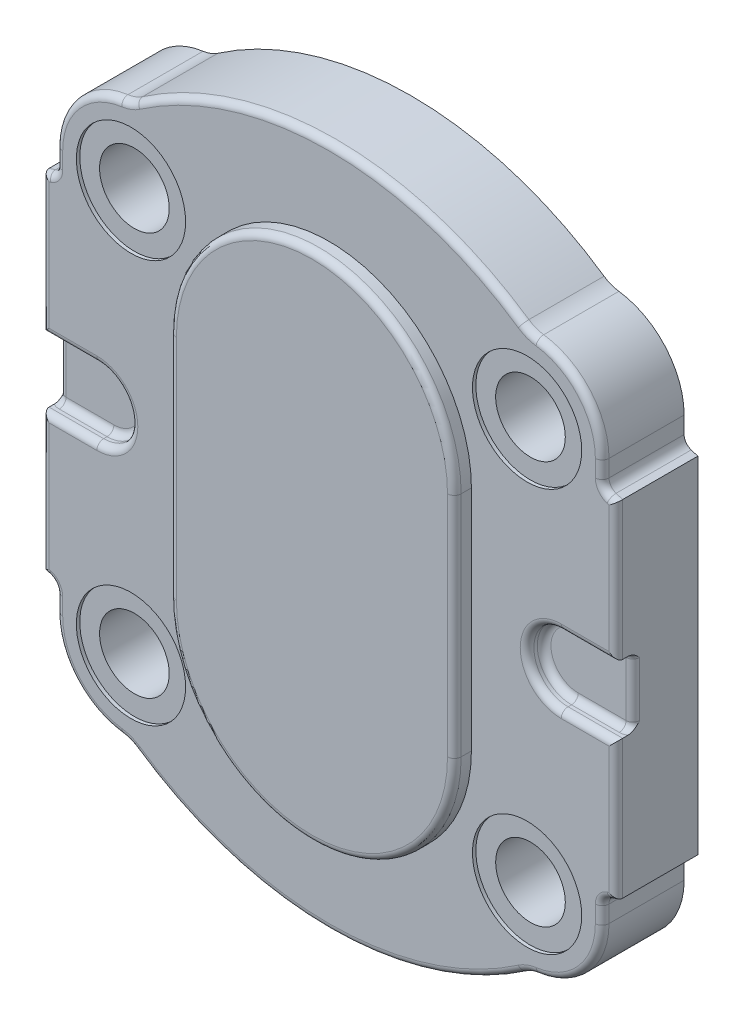
from build123d import *

# Parameters (mm, degrees)
SKETCH1_R                    = 5.1
BOSS_EXTRUDE1_DEPTH          = 12
BOSS_EXTRUDE2_DEPTH          = 2.5
CUT_EXTRUDE1_DEPTH           = 2.5
SKETCH4_R                    = 8
CUT_EXTRUDE3_DEPTH           = 0.5
FILLET1_R                    = 1
FILLET2_R                    = 1
FILLET3_R                    = 1
F_4_0_4_DIAMETER_HOLE2_D     = 4
F_4_0_4_DIAMETER_HOLE2_DEPTH = 3
F_4_0_4_DIAMETER_HOLE2_TIP   = 1.201721238


with BuildPart() as part:
    # Sketch1 → Boss-Extrude1 (new body)
    with BuildSketch(Plane.XY):
        with BuildLine():
            Line((-40, 29.5), (-40, 27.019246817))
            ThreePointArc((-40, 27.019246817), (-40.286592121, 26.137407082), (-41.036855092, 25.59253844))
            Line((-41.036855092, 25.59253844), (-42, 25.279877726))
            Line((-42, 25.279877726), (-42, -25.279877726))
            Line((-42, -25.279877726), (-41.036855092, -25.59253844))
            ThreePointArc((-41.036855092, -25.59253844), (-40.286592121, -26.137407082), (-40, -27.019246817))
            Line((-40, -27.019246817), (-40, -29.5))
            ThreePointArc((-40, -29.5), (-37.273414339, -36.74918031), (-30.445342697, -40.404631332))
            ThreePointArc((-30.445342697, -40.404631332), (-29.311006992, -40.693176357), (-28.274833318, -41.237529034))
            ThreePointArc((-28.274833318, -41.237529034), (0, -50), (28.274833318, -41.237529034))
            ThreePointArc((28.274833318, -41.237529034), (29.311006992, -40.693176357), (30.445342697, -40.404631332))
            ThreePointArc((30.445342697, -40.404631332), (37.273414339, -36.74918031), (40, -29.5))
            Line((40, -29.5), (40, -27.019246817))
            ThreePointArc((40, -27.019246817), (40.286592121, -26.137407082), (41.036855092, -25.59253844))
            Line((41.036855092, -25.59253844), (42, -25.279877726))
            Line((42, -25.279877726), (42, 25.279877726))
            Line((42, 25.279877726), (41.036855092, 25.59253844))
            ThreePointArc((41.036855092, 25.59253844), (40.286592121, 26.137407082), (40, 27.019246817))
            Line((40, 27.019246817), (40, 29.5))
            ThreePointArc((40, 29.5), (37.273414339, 36.74918031), (30.445342697, 40.404631332))
            ThreePointArc((30.445342697, 40.404631332), (29.311006992, 40.693176357), (28.274833318, 41.237529034))
            ThreePointArc((28.274833318, 41.237529034), (0, 50), (-28.274833318, 41.237529034))
            ThreePointArc((-28.274833318, 41.237529034), (-29.311006992, 40.693176357), (-30.445342697, 40.404631332))
            ThreePointArc((-30.445342697, 40.404631332), (-37.273414339, 36.74918031), (-40, 29.5))
        make_face()
        with Locations((-29, 29.5)):
            Circle(SKETCH1_R, mode=Mode.SUBTRACT)
        with Locations((29, 29.5)):
            Circle(SKETCH1_R, mode=Mode.SUBTRACT)
        with Locations(Location((29, -29.5, 0), (0, 0, 180))):
            Circle(SKETCH1_R, mode=Mode.SUBTRACT)
        with Locations(Location((-29, -29.5, 0), (0, 0, 180))):
            Circle(SKETCH1_R, mode=Mode.SUBTRACT)
    extrude(amount=BOSS_EXTRUDE1_DEPTH)

    # Sketch2 → Boss-Extrude2 (add)
    with BuildSketch(Plane.XY.offset(12)):
        with BuildLine():
            Line((20.85, 16.68), (20.85, -16.68))
            ThreePointArc((20.85, -16.68), (0, -37.53), (-20.85, -16.68))
            Line((-20.85, -16.68), (-20.85, 16.68))
            ThreePointArc((-20.85, 16.68), (0, 37.53), (20.85, 16.68))
        make_face()
    extrude(amount=BOSS_EXTRUDE2_DEPTH)

    # Sketch3 → Cut-Extrude1 (cut)
    with BuildSketch(Plane.XY.offset(12)):
        with BuildLine():
            Line((-34, -5), (-46.286310745, -5))
            Line((-46.286310745, -5), (-46.286310745, 5))
            Line((-46.286310745, 5), (-34, 5))
            ThreePointArc((-34, 5), (-29, 0), (-34, -5))
        make_face()
        with BuildLine():
            Line((46.286310745, -5), (46.286310745, 5))
            Line((46.286310745, 5), (34, 5))
            ThreePointArc((34, 5), (29, 0), (34, -5))
            Line((34, -5), (46.286310745, -5))
        make_face()
    extrude(amount=-CUT_EXTRUDE1_DEPTH, mode=Mode.SUBTRACT)

    # Sketch4 → Cut-Extrude3 (cut)
    with BuildSketch(Plane.XY.offset(12)):
        with Locations((-29, 29.5)):
            Circle(SKETCH4_R)
        with Locations((29, 29.5)):
            Circle(SKETCH4_R)
        with Locations((29, -29.5)):
            Circle(SKETCH4_R)
        with Locations((-29, -29.5)):
            Circle(SKETCH4_R)
    extrude(amount=-CUT_EXTRUDE3_DEPTH, mode=Mode.SUBTRACT)

    # Fillet1
    fillet1_edges = [part.edges().sort_by_distance(p)[0] for p in [
        (-38, 5, 12),
        (-38, -5, 12),
        (-29, 0, 12),
        (38, 5, 12),
        (29, 0, 12),
        (38, -5, 12),
        (-42, 15.139938863, 12),
        (-41.518427546, -25.436208083, 12),
        (-40.286592121, -26.137407082, 12),
        (-40, -28.259623409, 12),
        (-37.273414339, -36.74918031, 12),
        (-29.311006992, -40.693176357, 12),
        (0, -50, 12),
        (29.311006992, -40.693176357, 12),
        (37.273414339, -36.74918031, 12),
        (40, -28.259623409, 12),
        (-40.286592121, 26.137407082, 12),
        (40.286592121, -26.137407082, 12),
        (41.518427546, -25.436208083, 12),
        (42, -15.139938863, 12),
        (41.518427546, 25.436208083, 12),
        (40.286592121, 26.137407082, 12),
        (40, 28.259623409, 12),
        (37.273414339, 36.74918031, 12),
        (29.311006992, 40.693176357, 12),
        (0, 50, 12),
        (0, 37.53, 14.5),
        (-20.85, 0, 14.5),
        (0, -37.53, 14.5),
        (-29.311006992, 40.693176357, 12),
        (20.85, 0, 14.5),
        (-41.518427546, 25.436208083, 12),
        (-37.273414339, 36.74918031, 12),
        (-40, 28.259623409, 12),
        (42, 15.139938863, 12),
        (42, 0, 9.5),
        (-42, -15.139938863, 12),
        (-42, 0, 9.5),
    ]]
    fillet(fillet1_edges, radius=FILLET1_R)

    # Fillet2
    # the kernel refuses this fillet: 1 mm, written as the material it adds along each edge
    with BuildSketch(Plane(origin=(-41, 5, 9.5), x_dir=(0, -1, 0), z_dir=(1, 0, 0)), Plane(origin=(-34, -5, 9.5), x_dir=(0, 1, 0), z_dir=(-1, 0, 0))) as fillet2_piece_1:
        with BuildLine():
            CenterArc((FILLET2_R, -FILLET2_R), FILLET2_R, 90, 90)
            Line((0, -FILLET2_R), (0, 0))
            Line((0, 0), (FILLET2_R, 0))
        make_face()
    extrude(amount=7)
    with BuildSketch(Plane(origin=(-34, 0, 9.5), x_dir=(0, 1, 0), z_dir=(-1, 0, 0))) as fillet2_piece_2:
        with BuildLine():
            CenterArc((5 - FILLET2_R, -FILLET2_R), FILLET2_R, 0, 90)
            Line((5 - FILLET2_R, 0), (5, 0))
            Line((5, 0), (5, -FILLET2_R))
        make_face()
    revolve(axis=Axis((-34, 0, 9.5), (0, 0, -1)), revolution_arc=180)
    with BuildSketch(Plane(origin=(-41, -5, 8.5), x_dir=(0.8017442392976482, 0, -0.5976672776328277), z_dir=(0.5976672776328277, 0, 0.8017442392976482))) as fillet2_piece_3_section:
        with BuildLine():
            CenterArc((1 + FILLET2_R, FILLET2_R), FILLET2_R, 180, 90)
            Line((1, FILLET2_R), (1, 0))
            Line((1, 0), (1 + FILLET2_R, 0))
        make_face()
    fillet2_piece_3 = revolve(axis=Axis((-41, -5, 8.5), (0, 1, 0)), revolution_arc=233.296989237, mode=Mode.PRIVATE)
    fillet2_piece_3 = split(fillet2_piece_3, bisect_by=Plane(origin=(-42, -4.688371715, 9.249938952), z_dir=(1, 0, 0)), keep=Keep.TOP, mode=Mode.PRIVATE)
    add(fillet2_piece_3)
    with BuildSketch(Plane(origin=(-41, 5, 8.5), x_dir=(0.8017442392976482, 0, -0.5976672776328277), z_dir=(0.5976672776328277, 0, 0.8017442392976482))) as fillet2_piece_4_section:
        with BuildLine():
            CenterArc((1 + FILLET2_R, -FILLET2_R), FILLET2_R, 90, 90)
            Line((1 + FILLET2_R, 0), (1, 0))
            Line((1, 0), (1, -FILLET2_R))
        make_face()
    fillet2_piece_4 = revolve(axis=Axis((-41, 5, 8.5), (0, 1, 0)), revolution_arc=233.296989237, mode=Mode.PRIVATE)
    fillet2_piece_4 = split(fillet2_piece_4, bisect_by=Plane(origin=(-42, 4.688371693, 9.249938947), z_dir=(1, 0, 0)), keep=Keep.TOP, mode=Mode.PRIVATE)
    add(fillet2_piece_4)

    # Fillet3
    # the kernel refuses this fillet: 1 mm, written as the material it adds along each edge
    with BuildSketch(Plane(origin=(34, -5, 9.5), x_dir=(0, 0, 1), z_dir=(1, 0, 0)), Plane(origin=(41, 5, 9.5), x_dir=(0, 0, 1), z_dir=(-1, 0, 0))) as fillet3_piece_1:
        with BuildLine():
            CenterArc((FILLET3_R, -FILLET3_R), FILLET3_R, 90, 90)
            Line((0, -FILLET3_R), (0, 0))
            Line((0, 0), (FILLET3_R, 0))
        make_face()
    extrude(amount=7)
    with BuildSketch(Plane(origin=(34, 0, 9.5), x_dir=(0, 1, 0), z_dir=(1, 0, 0))) as fillet3_piece_2:
        with BuildLine():
            CenterArc((5 - FILLET3_R, FILLET3_R), FILLET3_R, 270, 90)
            Line((5 - FILLET3_R, 0), (5, 0))
            Line((5, 0), (5, FILLET3_R))
        make_face()
    revolve(axis=Axis((34, 0, 9.5), (0, 0, 1)), revolution_arc=180)
    with BuildSketch(Plane(origin=(41, -5, 8.5), x_dir=(-0.8017442392976482, 0, -0.5976672776328277), z_dir=(-0.5976672776328277, 0, 0.8017442392976482))) as fillet3_piece_3_section:
        with BuildLine():
            CenterArc((1 + FILLET3_R, -FILLET3_R), FILLET3_R, 90, 90)
            Line((1, -FILLET3_R), (1, 0))
            Line((1, 0), (1 + FILLET3_R, 0))
        make_face()
    fillet3_piece_3 = revolve(axis=Axis((41, -5, 8.5), (0, -1, 0)), revolution_arc=233.296989237, mode=Mode.PRIVATE)
    fillet3_piece_3 = split(fillet3_piece_3, bisect_by=Plane(origin=(42, -4.688371714, 9.249938953), z_dir=(-1, 0, 0)), keep=Keep.TOP, mode=Mode.PRIVATE)
    add(fillet3_piece_3)
    with BuildSketch(Plane(origin=(41, 5, 8.5), x_dir=(-0.8017442392976482, 0, -0.5976672776328277), z_dir=(-0.5976672776328277, 0, 0.8017442392976482))) as fillet3_piece_4_section:
        with BuildLine():
            CenterArc((1 + FILLET3_R, FILLET3_R), FILLET3_R, 180, 90)
            Line((1 + FILLET3_R, 0), (1, 0))
            Line((1, 0), (1, FILLET3_R))
        make_face()
    fillet3_piece_4 = revolve(axis=Axis((41, 5, 8.5), (0, -1, 0)), revolution_arc=233.296989237, mode=Mode.PRIVATE)
    fillet3_piece_4 = split(fillet3_piece_4, bisect_by=Plane(origin=(42, 4.688371695, 9.249938947), z_dir=(-1, 0, 0)), keep=Keep.TOP, mode=Mode.PRIVATE)
    add(fillet3_piece_4)

    # Ø4.0 (4) Diameter Hole2
    with Locations(Plane(origin=(0, 0, 0), x_dir=(-1, 0, 0), z_dir=(0, 0, -1))):
        with Locations((0, 45), (0, -45)):
            Hole(F_4_0_4_DIAMETER_HOLE2_D / 2, depth=F_4_0_4_DIAMETER_HOLE2_DEPTH)
            with Locations((0, 0, -(F_4_0_4_DIAMETER_HOLE2_DEPTH + F_4_0_4_DIAMETER_HOLE2_TIP / 2))):  # 118° drill point
                Cone(0, F_4_0_4_DIAMETER_HOLE2_D / 2, F_4_0_4_DIAMETER_HOLE2_TIP, mode=Mode.SUBTRACT)


solid = part.part
